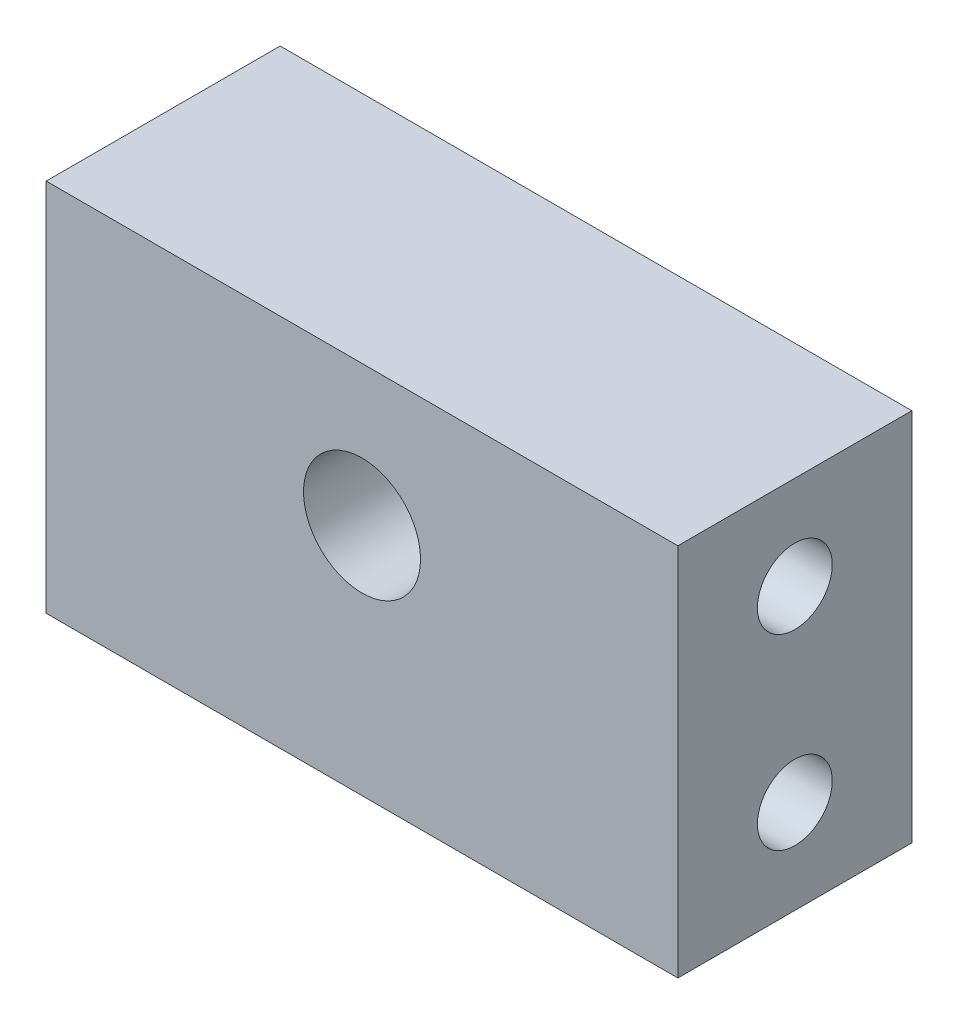
from build123d import *

# Parameters (mm, degrees)
ESQUISSE1_W                               = 13.5
ESQUISSE1_H                               = 8
BOSS_EXTRU_1_DEPTH                        = 5
TROU_POUR_TARAUDAGE_POUR_TROU_TARAUD_M2_D = 1.6
TROU_POUR_TARAUDAGE_POUR_TROU_TARAUD_M3_D = 2.5


with BuildPart() as part:
    # Esquisse1 → Boss.-Extru.1 (new body)
    with BuildSketch(Plane.XY):
        with Locations((6.75, 4)):
            Rectangle(ESQUISSE1_W, ESQUISSE1_H)
    extrude(amount=BOSS_EXTRU_1_DEPTH)

    # Trou pour taraudage pour trou taraudé M21 (through all)
    with Locations(Plane.ZY):
        with Locations((2.5, 6), (2.5, 2)):
            Hole(TROU_POUR_TARAUDAGE_POUR_TROU_TARAUD_M2_D / 2)

    # Trou pour taraudage pour trou taraudé M32 (through all)
    with Locations(Plane.XY.offset(5)):
        with Locations((6.75, 5)):
            Hole(TROU_POUR_TARAUDAGE_POUR_TROU_TARAUD_M3_D / 2)


solid = part.part
